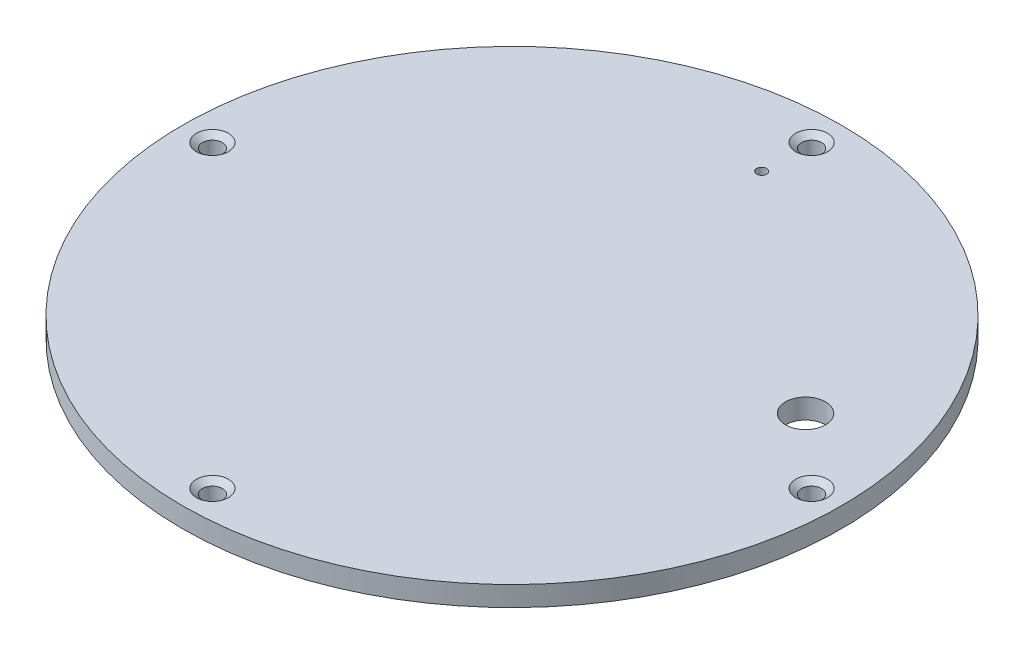
from build123d import *

# Parameters (mm, degrees)
SKETCH1_R                                       = 16.5
BOSS_EXTRUDE1_DEPTH                             = 1
CUT_EXTRUDE1_DEPTH                              = 24.355941428
CUT_EXTRUDE1_DEPTH_BACK                         = 24.355941428
SKETCH6_R                                       = 0.25
SKETCH6_R_2                                     = 1
CSK_FOR_M2_FLAT_HEAD_MACHINE_SCREW1_D           = 1
CSK_FOR_M2_FLAT_HEAD_MACHINE_SCREW1_CSINK_D     = 1.6
CSK_FOR_M2_FLAT_HEAD_MACHINE_SCREW1_CSINK_ANGLE = 100


with BuildPart() as part:
    # Sketch1 → Boss-Extrude1 (new body)
    with BuildSketch(Plane(origin=(0, 0, 0), x_dir=(1, 0, 0), z_dir=(0, 1, 0))):
        Circle(SKETCH1_R)
    extrude(amount=BOSS_EXTRUDE1_DEPTH)

    # Sketch6 → Cut-Extrude1 (cut, two sides: drawn at the far end of the back side and taken through both)
    with BuildSketch(Plane(origin=(0, 1, 0), x_dir=(1, 0, 0), z_dir=(0, 1, 0)).offset(-CUT_EXTRUDE1_DEPTH_BACK)):
        with Locations((0, 12.5)):
            Circle(SKETCH6_R)
        with Locations((11.591109915, 3.105828541)):
            Circle(SKETCH6_R_2)
    extrude(amount=CUT_EXTRUDE1_DEPTH + CUT_EXTRUDE1_DEPTH_BACK, mode=Mode.SUBTRACT)

    # CSK for M2 Flat Head Machine Screw1 (through all)
    with Locations(Plane(origin=(0, 1, 0), x_dir=(1, 0, 0), z_dir=(0, 1, 0))):
        with Locations((0, 15), (-15, 0), (0, -15), (15, 0)):
            CounterSinkHole(CSK_FOR_M2_FLAT_HEAD_MACHINE_SCREW1_D / 2, CSK_FOR_M2_FLAT_HEAD_MACHINE_SCREW1_CSINK_D / 2, counter_sink_angle=CSK_FOR_M2_FLAT_HEAD_MACHINE_SCREW1_CSINK_ANGLE)


solid = part.part
